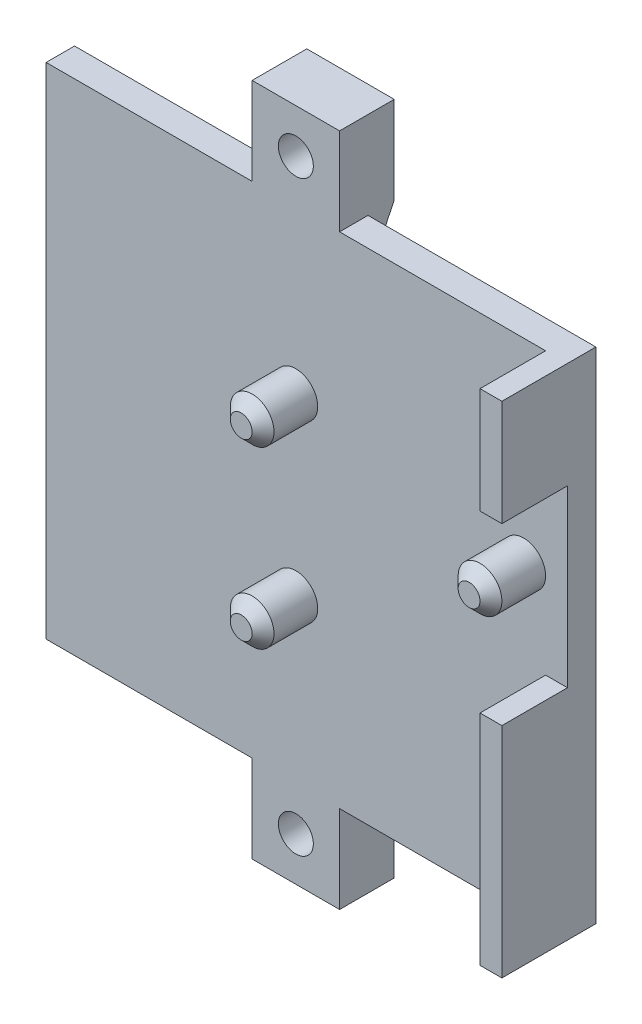
from build123d import *

# Parameters (mm, degrees)
BOSS_EXTRUDE1_DEPTH     = 1
FILLET2_R               = 1
SKETCH3_W               = 10
SKETCH3_H               = 7
BOSS_EXTRUDE2_DEPTH     = 2
SKETCH4_W               = 22.85
SKETCH4_H               = 22.85
BOSS_EXTRUDE3_DEPTH     = 1.3
SKETCH7_W               = 4
SKETCH7_H               = 4
BOSS_EXTRUDE4_DEPTH     = 2.5
FILLET3_R               = 10
FILLET4_R               = 10
TAP_DRILL_FOR_M2_TAP1_D = 1.6
SKETCH11_W              = 22.85
SKETCH11_H              = 1.3
BOSS_EXTRUDE5_DEPTH     = 1
SKETCH12_W              = 1
SKETCH12_H              = 10
SKETCH12_H_2            = 4.85
BOSS_EXTRUDE6_DEPTH     = 3
SKETCH13_R              = 1
BOSS_EXTRUDE7_DEPTH     = 2.5
CHAMFER2_SIZE           = 0.5


with BuildPart() as part:
    # Sketch2 → Boss-Extrude1 (new body)
    with BuildSketch(Plane(origin=(0, 0, 0), x_dir=(0, 1, 0), z_dir=(0, 0, 1))):
        Polygon((-7.2, 11.5), (-7.2, -11.5), (-4.8, -11.5), (-4.8, -10), (4.8, -10), (4.8, -11.5), (7.2, -11.5), (7.2, 11.5), (4.8, 11.5), (4.8, 5.1), (-4.8, 5.1), (-4.8, 11.5), align=None)
    extrude(amount=BOSS_EXTRUDE1_DEPTH)

    # Fillet2
    fillet2_edges = [part.edges().sort_by_distance(p)[0] for p in [
        (11.5, 7.2, 0.5),
        (11.5, 4.8, 0.5),
        (11.5, -4.8, 0.5),
        (11.5, -7.2, 0.5),
        (-11.5, -7.2, 0.5),
        (-11.5, -4.8, 0.5),
        (-11.5, 4.8, 0.5),
        (-11.5, 7.2, 0.5),
    ]]
    fillet(fillet2_edges, radius=FILLET2_R)

    # Sketch3 → Boss-Extrude2 (add)
    with BuildSketch(Plane.XY.offset(1)):
        with Locations((2.45, 0)):
            Rectangle(SKETCH3_W, SKETCH3_H)
    extrude(amount=BOSS_EXTRUDE2_DEPTH)

    # Sketch4 → Boss-Extrude3 (add)
    with BuildSketch(Plane.XY.offset(3)):
        with Locations((2.45, 0)):
            Rectangle(SKETCH4_W, SKETCH4_H)
    extrude(amount=BOSS_EXTRUDE3_DEPTH)

    # Sketch7 → Boss-Extrude4 (add)
    with BuildSketch(Plane.XY.offset(4.3)):
        with Locations((2.45, 13.425)):
            Rectangle(SKETCH7_W, SKETCH7_H)
        with Locations((2.45, -13.425)):
            Rectangle(SKETCH7_W, SKETCH7_H)
    extrude(amount=-BOSS_EXTRUDE4_DEPTH)

    # Fillet3
    # the kernel refuses this fillet: 10 mm, written as the material it adds along each edge
    with BuildSketch(Plane(origin=(0.45, 11.425, 3), x_dir=(0, -1, 0), z_dir=(1, 0, 0))) as fillet3_piece_1:
        with BuildLine():
            CenterArc((4.749736835, 10), FILLET3_R, 241.642363424, 28.357636576)
            Line((0, 1.2), (0, 0))
            Line((0, 0), (4.749736835, 0))
        make_face()
    extrude(amount=4)

    # Fillet4
    # the kernel refuses this fillet: 10 mm, written as the material it adds along each edge
    with BuildSketch(Plane(origin=(4.45, -11.425, 3), x_dir=(0, 1, 0), z_dir=(-1, 0, 0))) as fillet4_piece_1:
        with BuildLine():
            CenterArc((4.749736835, 10), FILLET4_R, 241.642363424, 28.357636576)
            Line((0, 1.2), (0, 0))
            Line((0, 0), (4.749736835, 0))
        make_face()
    extrude(amount=4)

    # Tap Drill for M2 Tap1 (through all)
    with Locations(Plane.XY.offset(4.3)):
        with Locations((2.45, 13.425), (2.45, -13.425)):
            Hole(TAP_DRILL_FOR_M2_TAP1_D / 2)

    # Sketch11 → Boss-Extrude5 (add)
    with BuildSketch(Plane.YZ.offset(13.875)):
        with Locations((0, 3.65)):
            Rectangle(SKETCH11_W, SKETCH11_H)
    extrude(amount=BOSS_EXTRUDE5_DEPTH)

    # Sketch12 → Boss-Extrude6 (add)
    with BuildSketch(Plane.XY.offset(4.3)):
        with Locations((14.375, -6.425)):
            Rectangle(SKETCH12_W, SKETCH12_H)
        with Locations((14.375, 9)):
            Rectangle(SKETCH12_W, SKETCH12_H_2)
    extrude(amount=BOSS_EXTRUDE6_DEPTH)

    # Sketch13 → Boss-Extrude7 (add)
    with BuildSketch(Plane.XY.offset(4.3)):
        with Locations((12.875, 2.505)):
            Circle(SKETCH13_R)
        with Locations((2.45, 4)):
            Circle(SKETCH13_R)
        with Locations((2.45, -4)):
            Circle(SKETCH13_R)
    extrude(amount=BOSS_EXTRUDE7_DEPTH)

    # Chamfer2
    chamfer2_edges = [part.edges().sort_by_distance(p)[0] for p in [
        (11.875, 2.505, 6.8),
        (1.45, -4, 6.8),
        (1.45, 4, 6.8),
    ]]
    chamfer(chamfer2_edges, length=CHAMFER2_SIZE)


solid = part.part
